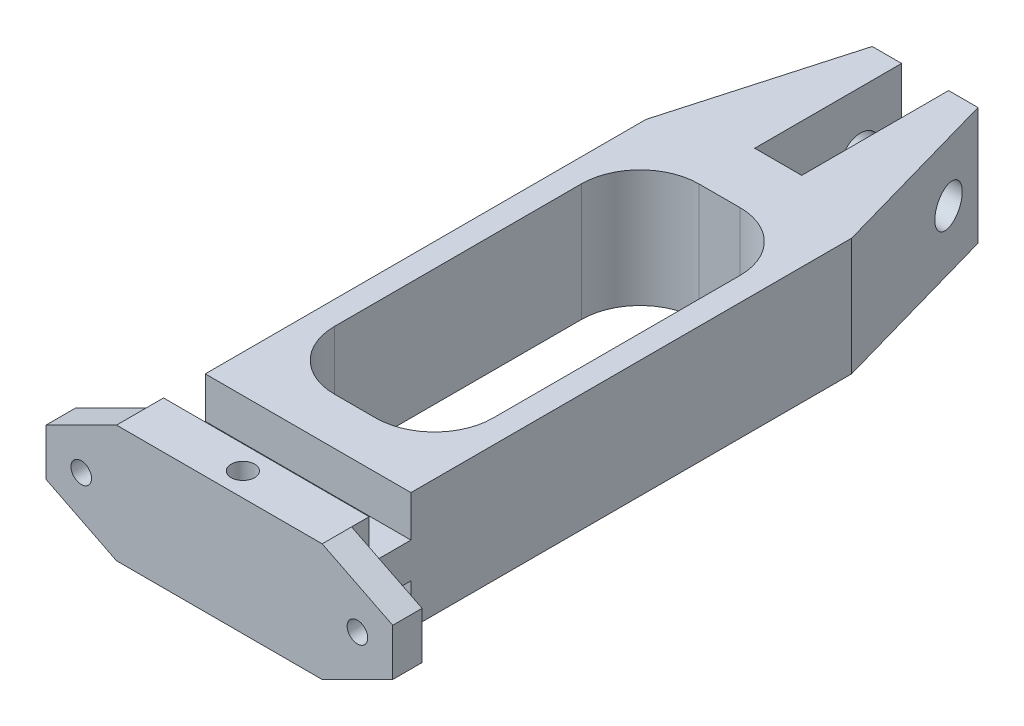
from build123d import *

# Parameters (mm, degrees)
CROQUIS1_R                 = 3.25
SALIENTE_EXTRUIR1_DEPTH    = 35
CORTAR_EXTRUIR1_REACH      = 128.685
CROQUIS2_W                 = 8
CROQUIS2_H                 = 25
CROQUIS4_W                 = 27
CROQUIS4_H                 = 62
CORTAR_EXTRUIR2_DEPTH      = 127.684687315
CORTAR_EXTRUIR3_REACH      = 128.685
CROQUIS9_R                 = 1.75
SALIENTE_EXTRUIR3_DEPTH    = 5
CHAFL_N1_SIZE              = 1.5
CHAFL_N1_OF_SIMETR_A3_SIZE = 1.5
ENGANCHE_REACH             = 132.511
CROQUIS7_R                 = 2
REDONDEO1_R                = 10


with BuildPart() as part:
    # Croquis1 → Saliente-Extruir1 (new body)
    with BuildSketch(Plane(origin=(0, 0, 0), x_dir=(0, 0, -1), z_dir=(1, 0, 0))):
        Polygon((0, 10), (0, -10), (8, -10), (8, -3), (15.1, -3), (15.1, -10), (120.1, -10), (120.1, 10), (15.1, 10), (15.1, 3), (8, 3), (8, 10), align=None)
        with Locations((113.1, 0)):
            Circle(CROQUIS1_R, mode=Mode.SUBTRACT)
    extrude(amount=SALIENTE_EXTRUIR1_DEPTH)

    # Croquis2 → Cortar-Extruir1 (cut, up to next)
    with BuildSketch(Plane(origin=(0, 10, 0), x_dir=(1, 0, 0), z_dir=(0, 1, 0)), mode=Mode.PRIVATE) as cortar_extruir1_sk1:
        with Locations((17.5, 107.6)):
            Rectangle(CROQUIS2_W, CROQUIS2_H)
    cortar_extruir1_tool1 = extrude(cortar_extruir1_sk1.sketch, amount=-CORTAR_EXTRUIR1_REACH, mode=Mode.PRIVATE) & part.part
    add(cortar_extruir1_tool1.solids().sort_by_distance((17.5, 10, -107.6))[0], mode=Mode.SUBTRACT)

    # Croquis4 → Cortar-Extruir2 (cut, through all)
    with BuildSketch(Plane(origin=(0, 10, 0), x_dir=(1, 0, 0), z_dir=(0, 1, 0))):
        with Locations((17.5, 54.1)):
            Rectangle(CROQUIS4_W, CROQUIS4_H)
    extrude(amount=-CORTAR_EXTRUIR2_DEPTH, mode=Mode.SUBTRACT)

    # Croquis5 → Cortar-Extruir3 (cut, up to next)
    with BuildSketch(Plane(origin=(0, 10, 0), x_dir=(1, 0, 0), z_dir=(0, 1, 0)), mode=Mode.PRIVATE) as cortar_extruir3_sk1:
        Polygon((8.5, 120.1), (0, 90.1), (0, 120.1), align=None)
    cortar_extruir3_tool1 = extrude(cortar_extruir3_sk1.sketch, amount=-CORTAR_EXTRUIR3_REACH, mode=Mode.PRIVATE) & part.part
    cortar_extruir3 = cortar_extruir3_tool1.solids().sort_by_distance((2.833333, 10, -110.1))[0]
    add(cortar_extruir3, mode=Mode.SUBTRACT)

    # Simetría1: Cortar-Extruir3 across plane
    add(cortar_extruir3.mirror(Plane(origin=(17.5, 0, 0), x_dir=(0, 0, 1), z_dir=(1, 0, 0))), mode=Mode.SUBTRACT)

    # Croquis9 → Saliente-Extruir3 (add)
    with BuildSketch(Plane.XY):
        Polygon((0, 10), (-12, 4), (-12, -4), (0, -10), align=None)
        with Locations((-6, 0)):
            Circle(CROQUIS9_R, mode=Mode.SUBTRACT)
    saliente_extruir3 = extrude(amount=-SALIENTE_EXTRUIR3_DEPTH)

    # Chaflán1
    chafl_n1_edges = [part.edges().sort_by_distance(p)[0] for p in [
        (-7.75, 0, -5),
    ]]
    chamfer(chafl_n1_edges, length=CHAFL_N1_SIZE)

    # Simetría3: Saliente-Extruir3 across plane
    add(saliente_extruir3.mirror(Plane(origin=(17.5, 0, 0), x_dir=(0, 0, 1), z_dir=(1, 0, 0))))

    # Chaflán1 of Simetría3
    chafl_n1_of_simetr_a3_edges = [part.edges().sort_by_distance(p)[0] for p in [
        (42.75, 0, -5),
    ]]
    chamfer(chafl_n1_of_simetr_a3_edges, length=CHAFL_N1_OF_SIMETR_A3_SIZE)

    # Croquis7 → Enganche (cut, up to next)
    with BuildSketch(Plane(origin=(0, 10, 0), x_dir=(1, 0, 0), z_dir=(0, 1, 0)), mode=Mode.PRIVATE) as enganche_sk1:
        with Locations((17.5, 4)):
            Circle(CROQUIS7_R)
    enganche_tool1 = extrude(enganche_sk1.sketch, amount=-ENGANCHE_REACH, mode=Mode.PRIVATE) & part.part
    add(enganche_tool1.solids().sort_by_distance((17.5, 10, -4))[0], mode=Mode.SUBTRACT)

    # Redondeo1
    redondeo1_edges = [part.edges().sort_by_distance(p)[0] for p in [
        (31, 0, -23.1),
        (4, 0, -23.1),
        (31, 0, -85.1),
        (4, 0, -85.1),
    ]]
    fillet(redondeo1_edges, radius=REDONDEO1_R)


solid = part.part
